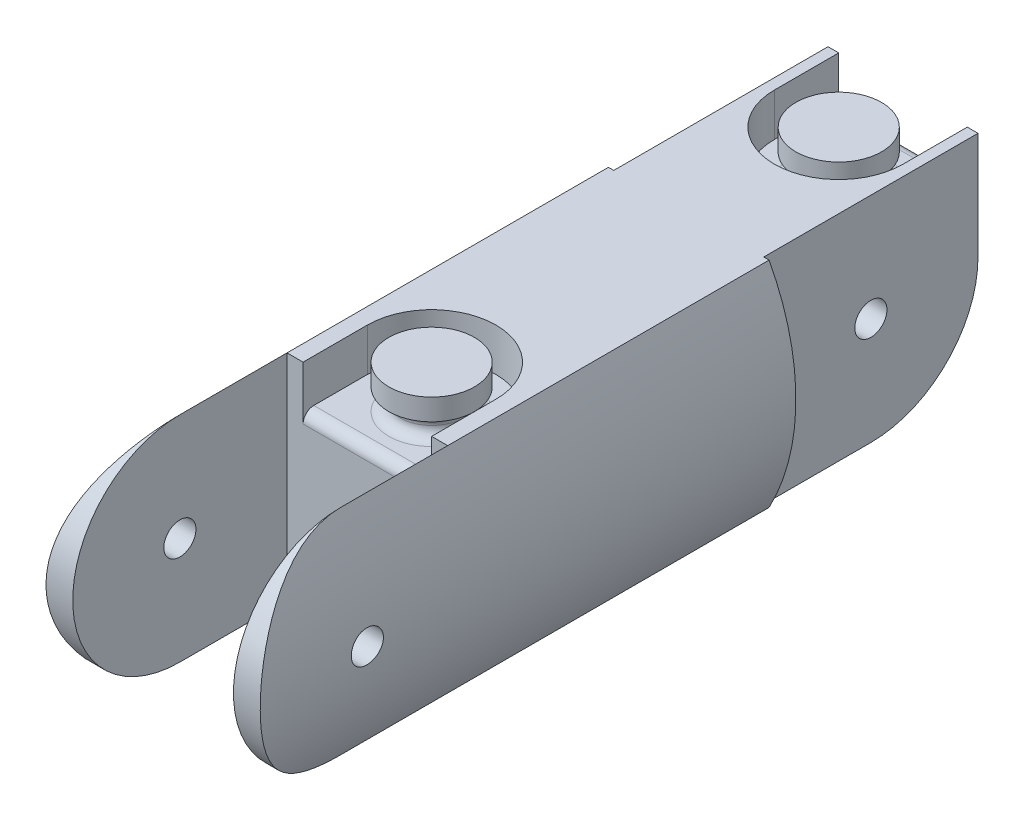
from build123d import *

# Parameters (mm, degrees)
SALIENTE_EXTRUIR2_DEPTH    = 50
CROQUIS4_R                 = 1.5
CORTAR_EXTRUIR1_DEPTH      = 50
SALIENTE_EXTRUIR3_DEPTH    = 20
CROQUIS8_R                 = 1.5
CORTAR_EXTRUIR4_DEPTH      = 14
REDONDEO1_R                = 10
CROQUIS6_W                 = 15
CROQUIS6_H                 = 20
CORTAR_EXTRUIR2_DEPTH      = 20
CORTAR_EXTRUIR3_DEPTH      = 52.961524227
CORTAR_EXTRUIR3_DEPTH_BACK = 52.961524227
CROQUIS7_R                 = 1.5
CUT_EXTRUDE1_DEPTH         = 4
SKETCH2_R                  = 3
BOSS_EXTRUDE1_DEPTH        = 2
SKETCH3_R                  = 4
BOSS_EXTRUDE2_DEPTH        = 2
FILLET1_R                  = 1
FILLET2_R                  = 1
FILLET3_R                  = 1


with BuildPart() as part:
    # Croquis2 → Saliente-Extruir2 (new body)
    with BuildSketch(Plane.XY):
        with BuildLine():
            Line((-7.5, -10), (7.5, -10))
            ThreePointArc((7.5, -10), (10, 0), (7.5, 10))
            Line((7.5, 10), (-7.5, 10))
            ThreePointArc((-7.5, 10), (-10, 0), (-7.5, -10))
        make_face()
    extrude(amount=SALIENTE_EXTRUIR2_DEPTH)

    # Croquis4 → Cortar-Extruir1 (cut)
    with BuildSketch(Plane(origin=(0, 0, 0), x_dir=(-1, 0, 0), z_dir=(0, 0, -1))):
        with Locations((0, -7)):
            Circle(CROQUIS4_R)
    extrude(amount=-CORTAR_EXTRUIR1_DEPTH, mode=Mode.SUBTRACT)

    # Croquis3 → Saliente-Extruir3 (add)
    with BuildSketch(Plane(origin=(0, 0, 0), x_dir=(-1, 0, 0), z_dir=(0, 0, -1))):
        Polygon((7, 10), (7, -10), (3, -10), (3, -3), (-3, -3), (-3, -10), (-7, -10), (-7, 10), align=None)
    extrude(amount=SALIENTE_EXTRUIR3_DEPTH)

    # Croquis8 → Cortar-Extruir4 (cut)
    with BuildSketch(Plane.ZY.offset(7)):
        with Locations((-10, 0)):
            Circle(CROQUIS8_R)
    extrude(amount=-CORTAR_EXTRUIR4_DEPTH, mode=Mode.SUBTRACT)

    # Redondeo1
    redondeo1_edges = [part.edges().sort_by_distance(p)[0] for p in [
        (5, -10, -20),
    ]]
    fillet(redondeo1_edges, radius=REDONDEO1_R)

    # Croquis6 → Cortar-Extruir2 (cut)
    with BuildSketch(Plane.XY.offset(50)):
        Rectangle(CROQUIS6_W, CROQUIS6_H)
    extrude(amount=-CORTAR_EXTRUIR2_DEPTH, mode=Mode.SUBTRACT)

    # Croquis7 → Cortar-Extruir3 (cut, two sides: drawn at the far end of the back side and taken through both)
    with BuildSketch(Plane(origin=(0, 0, 0), x_dir=(0, 0, -1), z_dir=(1, 0, 0)).offset(-CORTAR_EXTRUIR3_DEPTH_BACK)):
        with Locations((-40, 0)):
            Circle(CROQUIS7_R)
        with BuildLine():
            Line((-40, -10), (-55, -10))
            Line((-55, -10), (-55, 10))
            Line((-55, 10), (-40, 10))
            ThreePointArc((-40, 10), (-50, 0), (-40, -10))
        make_face()
    extrude(amount=CORTAR_EXTRUIR3_DEPTH + CORTAR_EXTRUIR3_DEPTH_BACK, mode=Mode.SUBTRACT)

    # Sketch1 → Cut-Extrude1 (cut)
    with BuildSketch(Plane(origin=(0, 10, 0), x_dir=(1, 0, 0), z_dir=(0, 1, 0))):
        with BuildLine():
            Line((-6, 14), (-6, 20))
            Line((-6, 20), (6, 20))
            Line((6, 20), (6, 14))
            ThreePointArc((6, 14), (0, 8), (-6, 14))
        make_face()
        with BuildLine():
            Line((-6, -24), (-6, -30))
            Line((-6, -30), (6, -30))
            Line((6, -30), (6, -24))
            ThreePointArc((6, -24), (0, -18), (-6, -24))
        make_face()
    extrude(amount=-CUT_EXTRUDE1_DEPTH, mode=Mode.SUBTRACT)

    # Sketch2 → Boss-Extrude1 (add)
    with BuildSketch(Plane(origin=(0, 6, 0), x_dir=(1, 0, 0), z_dir=(0, 1, 0))):
        with Locations(Location((0, 14, 0), (0, 0, 270))):
            Circle(SKETCH2_R)
        with Locations(Location((0, -24, 0), (0, 0, 270))):
            Circle(SKETCH2_R)
    extrude(amount=BOSS_EXTRUDE1_DEPTH)

    # Sketch3 → Boss-Extrude2 (add)
    with BuildSketch(Plane(origin=(0, 8, 0), x_dir=(1, 0, 0), z_dir=(0, 1, 0))):
        with Locations(Location((0, -24, 0), (0, 0, 270))):
            Circle(SKETCH3_R)
        with Locations(Location((0, 14, 0), (0, 0, 270))):
            Circle(SKETCH3_R)
    extrude(amount=BOSS_EXTRUDE2_DEPTH)

    # Fillet1
    fillet1_edges = [part.edges().sort_by_distance(p)[0] for p in [
        (0, 6, 21),
        (0, 8, 21),
        (0, 6, -17),
        (0, 8, -17),
    ]]
    fillet(fillet1_edges, radius=FILLET1_R - 0.0001)  # a hair under: the kernel refuses the full size

    # Fillet2
    fillet2_edges = [part.edges().sort_by_distance(p)[0] for p in [
        (0, 6, -20),
        (0, 6, 30),
    ]]
    fillet(fillet2_edges, radius=FILLET2_R)

    # Fillet3
    fillet3_edges = [part.edges().sort_by_distance(p)[0] for p in [
        (1.5, -7, 0),
        (1.5, -7, 30),
    ]]
    fillet(fillet3_edges, radius=FILLET3_R)


solid = part.part
